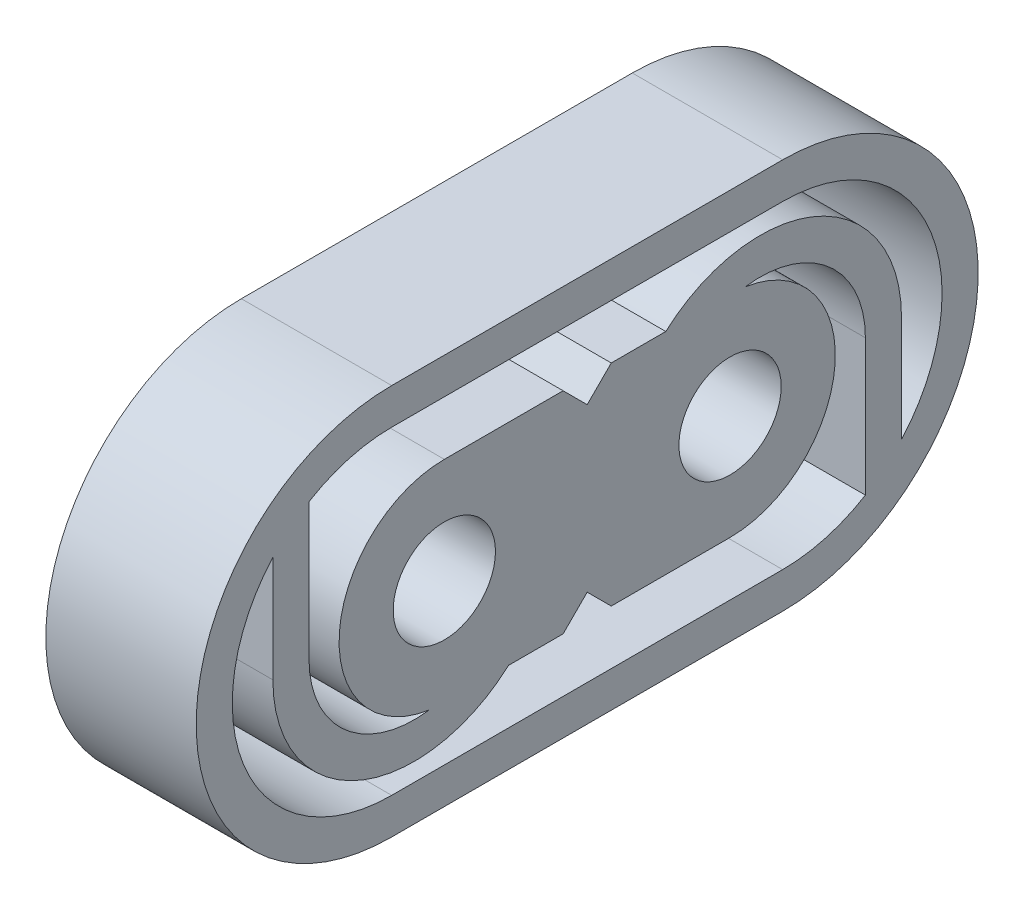
from build123d import *

# Parameters (mm, degrees)
SKETCH2_R           = 1.7
BOSS_EXTRUDE2_DEPTH = 5
CHAMFER2_SIZE       = 1.8


with BuildPart() as part:
    # Sketch2 → Boss-Extrude2 (new body)
    with BuildSketch(Plane.YZ):
        with BuildLine():
            Line((-6.472145094, 6.496243265), (-6.472145094, -6.503756735))
            ThreePointArc((-6.472145094, -6.503756735), (0.027854906, -13.003756735), (6.527854906, -6.503756735))
            Line((6.527854906, -6.503756735), (6.527854906, 6.496243265))
            ThreePointArc((6.527854906, 6.496243265), (0.027854906, 12.996243265), (-6.472145094, 6.496243265))
        make_face()
        with Locations(Location((0.027854906, 4.746243265, 0), (0, 0, 270))):
            Circle(SKETCH2_R, mode=Mode.SUBTRACT)
        with Locations(Location((0.027854906, -4.753756735, 0), (0, 0, 270))):
            Circle(SKETCH2_R, mode=Mode.SUBTRACT)
        with BuildLine():
            Line((-5.272145094, 6.496243265), (-5.272145094, -6.503756735))
            ThreePointArc((-5.272145094, -6.503756735), (-5.076205272, -7.931541625), (-4.502873512, -9.253756735))
            Line((-4.502873512, -9.253756735), (0.027854906, -9.253756735))
            ThreePointArc((0.027854906, -9.253756735), (2.673606218, -8.045044583), (3.491956522, -5.253756735))
            ThreePointArc((3.491956522, -5.253756735), (-0.222788612, -8.244770603), (-3.472145094, -4.753756735))
            Line((-3.472145094, -4.753756735), (-3.472145094, -0.803756735))
            Line((-3.472145094, -0.803756735), (-2.672145094, -0.003756735))
            Line((-2.672145094, -0.003756735), (-3.472145094, 0.796243265))
            Line((-3.472145094, 0.796243265), (-3.472145094, 2.609365837))
            ThreePointArc((-3.472145094, 2.609365837), (-4.263608941, 7.662838695), (0.027854906, 10.446243265))
            Line((0.027854906, 10.446243265), (3.561620603, 10.446243265))
            ThreePointArc((3.561620603, 10.446243265), (-2.135596249, 11.334577596), (-5.272145094, 6.496243265))
        make_face(mode=Mode.SUBTRACT)
        with BuildLine():
            Line((4.558583325, 9.246243265), (0.027854906, 9.246243265))
            ThreePointArc((0.027854906, 9.246243265), (-2.617896405, 8.037531112), (-3.436246709, 5.246243265))
            ThreePointArc((-3.436246709, 5.246243265), (0.278498425, 8.237257133), (3.527854906, 4.746243265))
            Line((3.527854906, 4.746243265), (3.527854906, 0.796243265))
            Line((3.527854906, 0.796243265), (2.727854906, -0.003756735))
            Line((2.727854906, -0.003756735), (3.527854906, -0.803756735))
            Line((3.527854906, -0.803756735), (3.527854906, -2.616879307))
            ThreePointArc((3.527854906, -2.616879307), (4.319318754, -7.670352166), (0.027854906, -10.453756735))
            Line((0.027854906, -10.453756735), (-3.50591079, -10.453756735))
            ThreePointArc((-3.50591079, -10.453756735), (2.191306062, -11.342091066), (5.327854906, -6.503756735))
            Line((5.327854906, -6.503756735), (5.327854906, 6.496243265))
            ThreePointArc((5.327854906, 6.496243265), (5.131915085, 7.924028155), (4.558583325, 9.246243265))
        make_face(mode=Mode.SUBTRACT)
    extrude(amount=BOSS_EXTRUDE2_DEPTH)

    # Chamfer2
    chamfer2_edges = [part.edges().sort_by_distance(p)[0] for p in [
        (0, 0.027854906, 6.446243265),
        (0, 0.027854906, -3.053756735),
    ]]
    chamfer(chamfer2_edges, length=CHAMFER2_SIZE - 0.0001)  # a hair under: the kernel refuses the full size


solid = part.part
